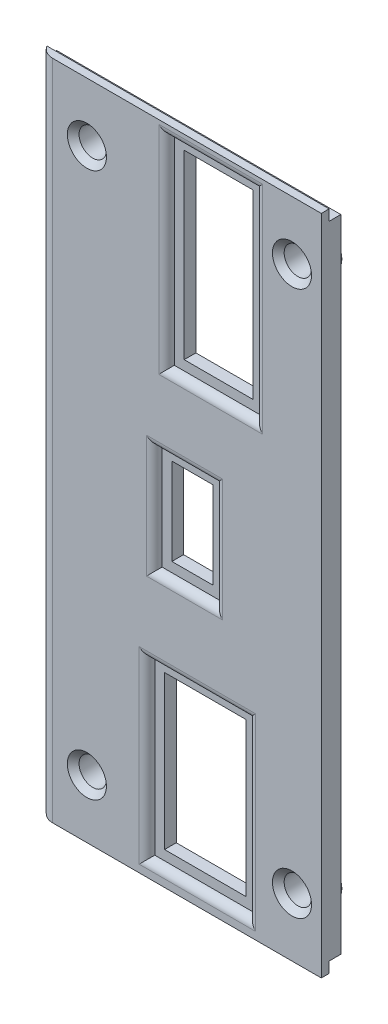
from build123d import *

# Parameters (mm, degrees)
SKETCH_2_W          = 29.1
SKETCH_2_H          = 67.8
EXTRUDE_1_DEPTH     = 0.8
SKETCH_3_W          = 29.1
SKETCH_3_H          = 65.6
EXTRUDE_2_DEPTH     = 1.2
SKETCH_4_R          = 1.4
SKETCH_4_W          = 7.042
SKETCH_4_H          = 18.5736
SKETCH_4_W_2        = 4.2
SKETCH_4_H_2        = 8.9
SKETCH_4_W_3        = 8.32
SKETCH_4_H_3        = 15.7
CUT_EXTRUDE_1_DEPTH = 37.944722221
SKETCH_5_R          = 2.1
SKETCH_5_R_2        = 1.1
SKETCH_5_R_3        = 1
EXTRUDE_3_DEPTH     = 1
SKETCH_6_W          = 1
SKETCH_6_H          = 65.6
EXTRUDE_4_DEPTH     = 1
CHAMFER_1_SIZE      = 1
CHAMFER_3_SIZE      = 1
SKETCH_7_W          = 9.042
SKETCH_7_H          = 20.5736
SKETCH_7_W_2        = 6.2
SKETCH_7_H_2        = 10.9
SKETCH_7_W_3        = 10.32
SKETCH_7_H_3        = 17.7
CUT_EXTRUDE_2_DEPTH = 0.8
FILLET_3_R          = 0.8
FILLET_4_R          = 0.8
FILLET_5_R          = 0.8
SKETCH_8_R          = 1.4
CUT_EXTRUDE_3_DEPTH = 37.944722221
CHAMFER_4_SIZE      = 0.6
FILLET_6_R          = 1.6


with BuildPart() as part:
    # Эскиз2 → Бобышка-Вытянуть1 (new body)
    with BuildSketch(Plane.XY):
        Rectangle(SKETCH_2_W, SKETCH_2_H)
    extrude(amount=EXTRUDE_1_DEPTH)

    # Эскиз3 → Бобышка-Вытянуть2 (add)
    with BuildSketch(Plane(origin=(0, 0, 0), x_dir=(-1, 0, 0), z_dir=(0, 0, -1))):
        Rectangle(SKETCH_3_W, SKETCH_3_H)
    extrude(amount=EXTRUDE_2_DEPTH)

    # Эскиз4 → Вырез-Вытянуть1 (cut, through all)
    with BuildSketch(Plane.XY.offset(0.8)):
        with Locations((-9.45, -27.9)):
            Circle(SKETCH_4_R)
        with Locations((11.55, -27.9)):
            Circle(SKETCH_4_R)
        with Locations((11.55, 27.9)):
            Circle(SKETCH_4_R)
        with Locations((-9.45, 27.9)):
            Circle(SKETCH_4_R)
        with Locations((3.229, 22.395)):
            Rectangle(SKETCH_4_W, SKETCH_4_H)
        with Locations((0.55, -0.961534596)):
            Rectangle(SKETCH_4_W_2, SKETCH_4_H_2)
        with Locations((1.86, -23.483733333)):
            Rectangle(SKETCH_4_W_3, SKETCH_4_H_3)
    extrude(amount=-CUT_EXTRUDE_1_DEPTH, mode=Mode.SUBTRACT)

    # Эскиз5 → Бобышка-Вытянуть3 (add)
    # profile 1 of 4: a face of its own
    with BuildSketch(Plane(origin=(0, 0, -1.2), x_dir=(-1, 0, 0), z_dir=(0, 0, -1))):
        with Locations((-11.55, 27.9)):
            Circle(SKETCH_5_R)
        with Locations((-11.55, 27.9)):
            Circle(SKETCH_5_R_2, mode=Mode.SUBTRACT)
    # profile 2 of 4: a face of its own
    with BuildSketch(Plane(origin=(0, 0, -1.2), x_dir=(-1, 0, 0), z_dir=(0, 0, -1))):
        with Locations((-11.55, -27.9)):
            Circle(SKETCH_5_R)
        with Locations((-11.55, -27.9)):
            Circle(SKETCH_5_R_2, mode=Mode.SUBTRACT)
    # profile 3 of 4: a face of its own
    with BuildSketch(Plane(origin=(0, 0, -1.2), x_dir=(-1, 0, 0), z_dir=(0, 0, -1))):
        with Locations((9.45, 27.9)):
            Circle(SKETCH_5_R)
        with Locations((9.45, 27.9)):
            Circle(SKETCH_5_R_3, mode=Mode.SUBTRACT)
    # profile 4 of 4: a face of its own
    with BuildSketch(Plane(origin=(0, 0, -1.2), x_dir=(-1, 0, 0), z_dir=(0, 0, -1))):
        with Locations((9.45, -27.9)):
            Circle(SKETCH_5_R)
        with Locations((9.45, -27.9)):
            Circle(SKETCH_5_R_3, mode=Mode.SUBTRACT)
    extrude(amount=EXTRUDE_3_DEPTH)

    # Эскиз6 → Бобышка-Вытянуть4 (add)
    with BuildSketch(Plane(origin=(0, 0, -1.2), x_dir=(-1, 0, 0), z_dir=(0, 0, -1))):
        with Locations((11.95, 0)):
            Rectangle(SKETCH_6_W, SKETCH_6_H)
    extrude(amount=EXTRUDE_4_DEPTH)

    # Фаска1
    chamfer_1_edges = [part.edges().sort_by_distance(p)[0] for p in [
        (-11.95, -32.8, -2.2),
        (-11.95, 32.8, -2.2),
    ]]
    chamfer(chamfer_1_edges, length=CHAMFER_1_SIZE)

    # Фаска3
    chamfer_3_edges = [part.edges().sort_by_distance(p)[0] for p in [
        (-11.45, -30.670156212, -1.2),
        (-11.45, 30.670156212, -1.2),
        (-11.45, 0, -1.2),
    ]]
    chamfer(chamfer_3_edges, length=CHAMFER_3_SIZE - 0.0001)  # a hair under: the kernel refuses the full size

    # Эскиз7 → Вырез-Вытянуть2 (cut)
    with BuildSketch(Plane.XY.offset(0.8)):
        with Locations((3.229, 22.395)):
            Rectangle(SKETCH_7_W, SKETCH_7_H)
        with Locations((0.55, -0.961534596)):
            Rectangle(SKETCH_7_W_2, SKETCH_7_H_2)
        with Locations((1.86, -23.483733333)):
            Rectangle(SKETCH_7_W_3, SKETCH_7_H_3)
    extrude(amount=-CUT_EXTRUDE_2_DEPTH, mode=Mode.SUBTRACT)

    # Скругление3
    fillet_3_edges = [part.edges().sort_by_distance(p)[0] for p in [
        (3.229, 12.1082, 0.8),
        (7.75, 22.395, 0.8),
        (3.229, 32.6818, 0.8),
        (-1.292, 22.395, 0.8),
    ]]
    fillet(fillet_3_edges, radius=FILLET_3_R - 0.0001)  # a hair under: the kernel refuses the full size

    # Скругление4
    fillet_4_edges = [part.edges().sort_by_distance(p)[0] for p in [
        (0.55, -6.411534596, 0.8),
        (-2.55, -0.961534596, 0.8),
        (0.55, 4.488465404, 0.8),
        (3.65, -0.961534596, 0.8),
    ]]
    fillet(fillet_4_edges, radius=FILLET_4_R - 0.0001)  # a hair under: the kernel refuses the full size

    # Скругление5
    fillet_5_edges = [part.edges().sort_by_distance(p)[0] for p in [
        (1.86, -32.333733333, 0.8),
        (-3.3, -23.483733333, 0.8),
        (1.86, -14.633733333, 0.8),
        (7.02, -23.483733333, 0.8),
    ]]
    fillet(fillet_5_edges, radius=FILLET_5_R - 0.0001)  # a hair under: the kernel refuses the full size

    # Эскиз8 → Вырез-Вытянуть3 (cut, through all)
    with BuildSketch(Plane.XY.offset(-1.2)):
        with Locations((11.55, 27.9)):
            Circle(SKETCH_8_R)
        with Locations((-9.45, -27.9)):
            Circle(SKETCH_8_R)
        with Locations((11.55, -27.9)):
            Circle(SKETCH_8_R)
        with Locations((-9.45, 27.9)):
            Circle(SKETCH_8_R)
    extrude(amount=-CUT_EXTRUDE_3_DEPTH, mode=Mode.SUBTRACT)

    # Фаска4
    chamfer_4_edges = [part.edges().sort_by_distance(p)[0] for p in [
        (10.15, -27.9, 0.8),
        (10.15, 27.9, 0.8),
        (-10.85, 27.9, 0.8),
        (-10.85, -27.9, 0.8),
    ]]
    chamfer(chamfer_4_edges, length=CHAMFER_4_SIZE)

    # Скругление6
    fillet_6_edges = [part.edges().sort_by_distance(p)[0] for p in [
        (-14.55, 0, 0.8),
    ]]
    fillet(fillet_6_edges, radius=FILLET_6_R)


solid = part.part
